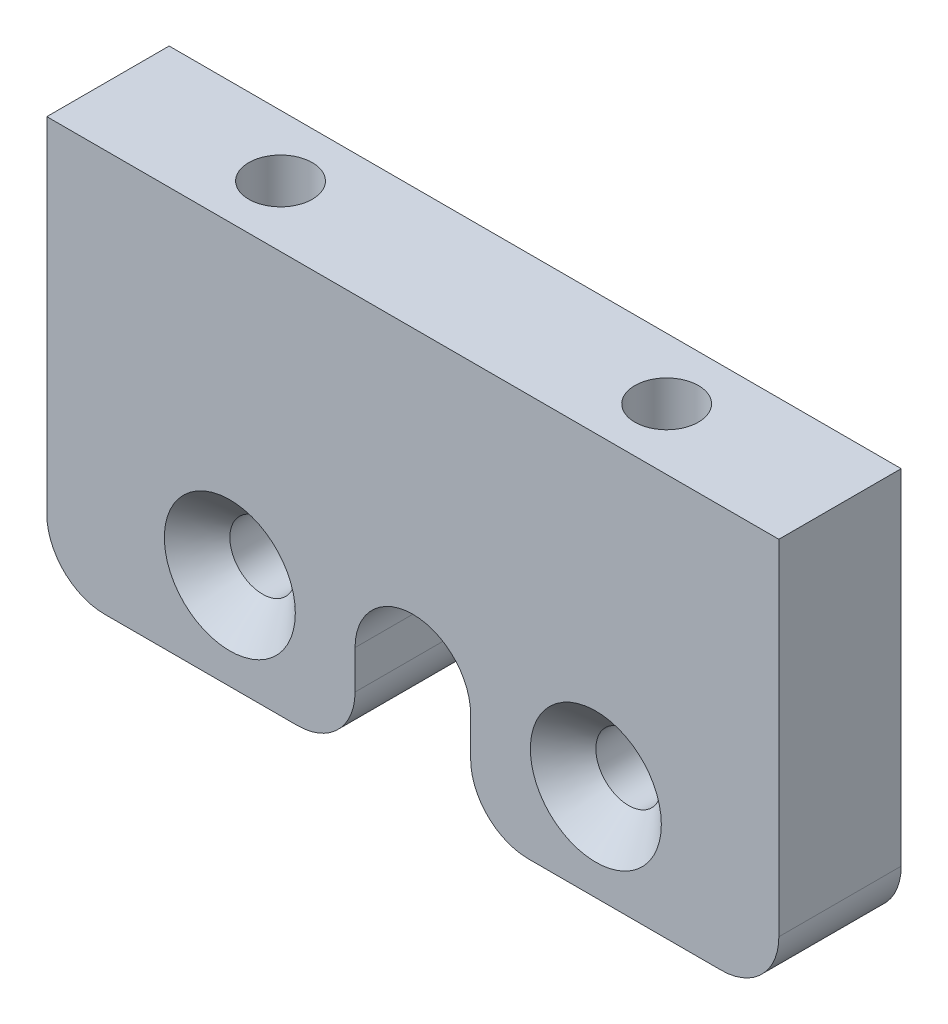
from build123d import *

# Parameters (mm, degrees)
SKETCH1_R           = 1.7
BOSS_EXTRUDE1_DEPTH = 6.35
CHAMFER1_SIZE       = 1.7
SKETCH2_R           = 1.65
CUT_EXTRUDE1_DEPTH  = 10
FILLET1_R           = 3


with BuildPart() as part:
    # Sketch1 → Boss-Extrude1 (new body)
    with BuildSketch(Plane(origin=(1.16e-07, 0, -33.253697298), x_dir=(1.0, 0, 3.501429786466588e-09), z_dir=(-3.501429786466588e-09, 0, 1.0))):
        with BuildLine():
            Line((3.000021754, 6.9987), (3.000021754, 1.9987))
            Line((3.000021754, 1.9987), (19.00000025, 1.9987))
            Line((19.00000025, 1.9987), (19.00000025, 22.8687))
            Line((19.00000025, 22.8687), (-19.00000025, 22.8687))
            Line((-19.00000025, 22.8687), (-19.00000025, 1.9987))
            Line((-19.00000025, 1.9987), (-3.000021754, 1.9987))
            Line((-3.000021754, 1.9987), (-3.000021754, 6.9987))
            ThreePointArc((-3.000021754, 6.9987), (2.5e-07, 9.998721503), (3.000021754, 6.9987))
        make_face()
        with Locations((9.49999975, 6.9987)):
            Circle(SKETCH1_R, mode=Mode.SUBTRACT)
        with Locations((-9.49999975, 6.9987)):
            Circle(SKETCH1_R, mode=Mode.SUBTRACT)
    extrude(amount=BOSS_EXTRUDE1_DEPTH)

    # Chamfer1
    chamfer1_edges = [part.edges().sort_by_distance(p)[0] for p in [
        (-11.199999655, 6.9987, -26.903697337),
        (7.799999844, 6.9987, -26.90369727),
    ]]
    chamfer(chamfer1_edges, length=CHAMFER1_SIZE)

    # Sketch2 → Cut-Extrude1 (cut)
    with BuildSketch(Plane(origin=(0, 22.8687, 0), x_dir=(1, 0, 0), z_dir=(0, 1, 0))):
        with Locations((10, 30.078697231)):
            Circle(SKETCH2_R)
        with Locations((-10.042850258, 30.078697231)):
            Circle(SKETCH2_R)
    extrude(amount=-CUT_EXTRUDE1_DEPTH, mode=Mode.SUBTRACT)

    # Fillet1
    fillet1_edges = [part.edges().sort_by_distance(p)[0] for p in [
        (-19.000000145, 1.9987, -30.078697364),
        (-3.000021648, 1.9987, -30.078697308),
        (3.000021859, 1.9987, -30.078697287),
        (19.000000356, 1.9987, -30.078697231),
    ]]
    fillet(fillet1_edges, radius=FILLET1_R)


solid = part.part
